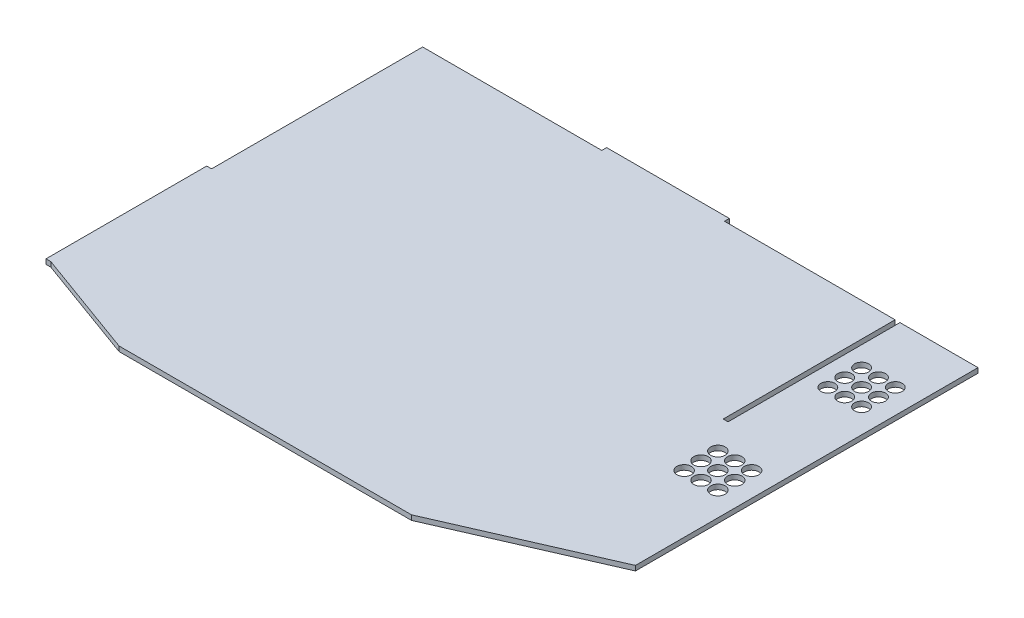
from build123d import *

# Parameters (mm, degrees)
SKETCH1_W                 = 308.11216
SKETCH1_H                 = 3.175
BOSS_EXTRUDE1_DEPTH       = 267.83
SKETCH3_W                 = 155.702
SKETCH3_H                 = 3.175
BOSS_EXTRUDE3_DEPTH       = 3.175
SKETCH4_W                 = 50.87366
SKETCH4_H                 = 3.175
BOSS_EXTRUDE4_DEPTH       = 267.83
CUT_EXTRUDE1_DEPTH        = 340.191055801
SKETCH8_W                 = 80
SKETCH8_H                 = 3.175
BOSS_EXTRUDE6_DEPTH       = 3.175
CUT_EXTRUDE3_DEPTH        = 340.191055801
SKETCH13_W                = 104.779999964
SKETCH13_H                = 3.1854967
BOSS_EXTRUDE7_DEPTH       = 3.175
SKETCH14_R                = 4.738291707
CUT_EXTRUDE4_DEPTH        = 340.191154218
LPATTERN1_COUNT           = 3
LPATTERN1_PITCH           = 11
LPATTERN2_COPY_1_SKETCH_R = 4.738291707
LPATTERN2_COPY_1_DEPTH    = 340.191154218
LPATTERN2_COPY_2_SKETCH_R = 4.738291707
LPATTERN2_COPY_2_DEPTH    = 340.191154218
LPATTERN2_COPY_3_SKETCH_R = 4.738291707
LPATTERN2_COPY_3_DEPTH    = 340.191154218
LPATTERN2_COPY_4_SKETCH_R = 4.738291707
LPATTERN2_COPY_4_DEPTH    = 340.191154218
LPATTERN2_COPY_5_SKETCH_R = 4.738291707
LPATTERN2_COPY_5_DEPTH    = 340.191154218
LPATTERN2_COPY_6_SKETCH_R = 4.738291707
LPATTERN2_COPY_6_DEPTH    = 340.191154218
SKETCH15_R                = 4.577737938
CUT_EXTRUDE5_DEPTH        = 340.191154218
LPATTERN3_COUNT           = 3
LPATTERN3_PITCH           = 11
LPATTERN4_COPY_1_SKETCH_R = 4.577737938
LPATTERN4_COPY_1_DEPTH    = 340.191154218
LPATTERN4_COPY_2_SKETCH_R = 4.577737938
LPATTERN4_COPY_2_DEPTH    = 340.191154218
LPATTERN4_COPY_3_SKETCH_R = 4.577737938
LPATTERN4_COPY_3_DEPTH    = 340.191154218
LPATTERN4_COPY_4_SKETCH_R = 4.577737938
LPATTERN4_COPY_4_DEPTH    = 340.191154218
LPATTERN4_COPY_5_SKETCH_R = 4.577737938
LPATTERN4_COPY_5_DEPTH    = 340.191154218
LPATTERN4_COPY_6_SKETCH_R = 4.577737938
LPATTERN4_COPY_6_DEPTH    = 340.191154218


with BuildPart() as part:
    # Sketch1 → Boss-Extrude1 (new body)
    with BuildSketch(Plane.XY):
        Rectangle(SKETCH1_W, SKETCH1_H)
    extrude(amount=BOSS_EXTRUDE1_DEPTH)

    # Sketch3 → Boss-Extrude3 (add)
    with BuildSketch(Plane(origin=(154.05608, 0, 0), x_dir=(0, 0, -1), z_dir=(1, 0, 0))):
        with Locations((-189.979, 0)):
            Rectangle(SKETCH3_W, SKETCH3_H)
    extrude(amount=BOSS_EXTRUDE3_DEPTH)

    # Sketch4 → Boss-Extrude4 (add)
    with BuildSketch(Plane.XY.offset(267.83)):
        with Locations((182.66791, 0)):
            Rectangle(SKETCH4_W, SKETCH4_H)
    extrude(amount=-BOSS_EXTRUDE4_DEPTH)

    # Sketch6 → Cut-Extrude1 (cut, through all)
    with BuildSketch(Plane(origin=(0, 1.5875, 0), x_dir=(1, 0, 0), z_dir=(0, 1, 0))):
        Polygon((208.10474, -223.38), (106.50474, -267.83), (208.10474, -267.83), align=None)
    extrude(amount=-CUT_EXTRUDE1_DEPTH, mode=Mode.SUBTRACT)

    # Sketch8 → Boss-Extrude6 (add)
    with BuildSketch(Plane(origin=(0, 0, 0), x_dir=(-1, 0, 0), z_dir=(0, 0, -1))):
        with Locations((-2.78399998, 0)):
            Rectangle(SKETCH8_W, SKETCH8_H)
    extrude(amount=BOSS_EXTRUDE6_DEPTH)

    # Sketch11 → Cut-Extrude3 (cut, through all)
    with BuildSketch(Plane.XZ.offset(1.5875)):
        Polygon((-154.05608, 242.43), (-84.20608, 267.83), (-154.05608, 267.83), align=None)
    extrude(amount=-CUT_EXTRUDE3_DEPTH, mode=Mode.SUBTRACT)

    # Sketch13 → Boss-Extrude7 (add)
    with BuildSketch(Plane.ZY.offset(154.05608)):
        with Locations((190.040000018, -0.00524835)):
            Rectangle(SKETCH13_W, SKETCH13_H)
    extrude(amount=BOSS_EXTRUDE7_DEPTH)

    # Sketch14 → Cut-Extrude4 (cut, through all)
    with BuildSketch(Plane(origin=(0, 1.5875, 0), x_dir=(1, 0, 0), z_dir=(0, 1, 0))):
        with Locations((192.41414994, -153.934302722)):
            Circle(SKETCH14_R)
    cut_extrude4 = extrude(amount=-CUT_EXTRUDE4_DEPTH, mode=Mode.SUBTRACT)

    # LPattern1: Cut-Extrude4 ×3
    with Locations(*[(-i * LPATTERN1_PITCH, 0, 0) for i in range(1, LPATTERN1_COUNT)]):
        add(cut_extrude4, mode=Mode.SUBTRACT)

    # LPattern2 copy 1 sketch → LPattern2 copy 1 (cut, through all)
    with BuildSketch(Plane(origin=(-11, 1.5875, -11), x_dir=(1, 0, 0), z_dir=(0, 1, 0))):
        with Locations((192.41414994, -153.934302722)):
            Circle(LPATTERN2_COPY_1_SKETCH_R)
    extrude(amount=-LPATTERN2_COPY_1_DEPTH, mode=Mode.SUBTRACT)

    # LPattern2 copy 2 sketch → LPattern2 copy 2 (cut, through all)
    with BuildSketch(Plane(origin=(-11, 1.5875, -22), x_dir=(1, 0, 0), z_dir=(0, 1, 0))):
        with Locations((192.41414994, -153.934302722)):
            Circle(LPATTERN2_COPY_2_SKETCH_R)
    extrude(amount=-LPATTERN2_COPY_2_DEPTH, mode=Mode.SUBTRACT)

    # LPattern2 copy 3 sketch → LPattern2 copy 3 (cut, through all)
    with BuildSketch(Plane(origin=(-22, 1.5875, -11), x_dir=(1, 0, 0), z_dir=(0, 1, 0))):
        with Locations((192.41414994, -153.934302722)):
            Circle(LPATTERN2_COPY_3_SKETCH_R)
    extrude(amount=-LPATTERN2_COPY_3_DEPTH, mode=Mode.SUBTRACT)

    # LPattern2 copy 4 sketch → LPattern2 copy 4 (cut, through all)
    with BuildSketch(Plane(origin=(-22, 1.5875, -22), x_dir=(1, 0, 0), z_dir=(0, 1, 0))):
        with Locations((192.41414994, -153.934302722)):
            Circle(LPATTERN2_COPY_4_SKETCH_R)
    extrude(amount=-LPATTERN2_COPY_4_DEPTH, mode=Mode.SUBTRACT)

    # LPattern2 copy 5 sketch → LPattern2 copy 5 (cut, through all)
    with BuildSketch(Plane(origin=(0, 1.5875, -11), x_dir=(1, 0, 0), z_dir=(0, 1, 0))):
        with Locations((192.41414994, -153.934302722)):
            Circle(LPATTERN2_COPY_5_SKETCH_R)
    extrude(amount=-LPATTERN2_COPY_5_DEPTH, mode=Mode.SUBTRACT)

    # LPattern2 copy 6 sketch → LPattern2 copy 6 (cut, through all)
    with BuildSketch(Plane(origin=(0, 1.5875, -22), x_dir=(1, 0, 0), z_dir=(0, 1, 0))):
        with Locations((192.41414994, -153.934302722)):
            Circle(LPATTERN2_COPY_6_SKETCH_R)
    extrude(amount=-LPATTERN2_COPY_6_DEPTH, mode=Mode.SUBTRACT)

    # Sketch15 → Cut-Extrude5 (cut, through all)
    with BuildSketch(Plane(origin=(0, 1.5875, 0), x_dir=(1, 0, 0), z_dir=(0, 1, 0))):
        with Locations((170.289783426, -38.1)):
            Circle(SKETCH15_R)
    cut_extrude5 = extrude(amount=-CUT_EXTRUDE5_DEPTH, mode=Mode.SUBTRACT)

    # LPattern3: Cut-Extrude5 ×3
    with Locations(*[(i * LPATTERN3_PITCH, 0, 0) for i in range(1, LPATTERN3_COUNT)]):
        add(cut_extrude5, mode=Mode.SUBTRACT)

    # LPattern4 copy 1 sketch → LPattern4 copy 1 (cut, through all)
    with BuildSketch(Plane(origin=(11, 1.5875, 11), x_dir=(1, 0, 0), z_dir=(0, 1, 0))):
        with Locations((170.289783426, -38.1)):
            Circle(LPATTERN4_COPY_1_SKETCH_R)
    extrude(amount=-LPATTERN4_COPY_1_DEPTH, mode=Mode.SUBTRACT)

    # LPattern4 copy 2 sketch → LPattern4 copy 2 (cut, through all)
    with BuildSketch(Plane(origin=(11, 1.5875, 22), x_dir=(1, 0, 0), z_dir=(0, 1, 0))):
        with Locations((170.289783426, -38.1)):
            Circle(LPATTERN4_COPY_2_SKETCH_R)
    extrude(amount=-LPATTERN4_COPY_2_DEPTH, mode=Mode.SUBTRACT)

    # LPattern4 copy 3 sketch → LPattern4 copy 3 (cut, through all)
    with BuildSketch(Plane(origin=(22, 1.5875, 11), x_dir=(1, 0, 0), z_dir=(0, 1, 0))):
        with Locations((170.289783426, -38.1)):
            Circle(LPATTERN4_COPY_3_SKETCH_R)
    extrude(amount=-LPATTERN4_COPY_3_DEPTH, mode=Mode.SUBTRACT)

    # LPattern4 copy 4 sketch → LPattern4 copy 4 (cut, through all)
    with BuildSketch(Plane(origin=(22, 1.5875, 22), x_dir=(1, 0, 0), z_dir=(0, 1, 0))):
        with Locations((170.289783426, -38.1)):
            Circle(LPATTERN4_COPY_4_SKETCH_R)
    extrude(amount=-LPATTERN4_COPY_4_DEPTH, mode=Mode.SUBTRACT)

    # LPattern4 copy 5 sketch → LPattern4 copy 5 (cut, through all)
    with BuildSketch(Plane(origin=(0, 1.5875, 11), x_dir=(1, 0, 0), z_dir=(0, 1, 0))):
        with Locations((170.289783426, -38.1)):
            Circle(LPATTERN4_COPY_5_SKETCH_R)
    extrude(amount=-LPATTERN4_COPY_5_DEPTH, mode=Mode.SUBTRACT)

    # LPattern4 copy 6 sketch → LPattern4 copy 6 (cut, through all)
    with BuildSketch(Plane(origin=(0, 1.5875, 22), x_dir=(1, 0, 0), z_dir=(0, 1, 0))):
        with Locations((170.289783426, -38.1)):
            Circle(LPATTERN4_COPY_6_SKETCH_R)
    extrude(amount=-LPATTERN4_COPY_6_DEPTH, mode=Mode.SUBTRACT)


solid = part.part
